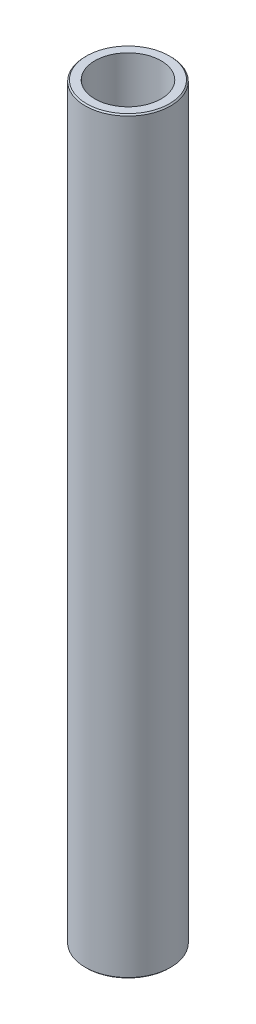
from build123d import *

# Parameters (mm, degrees)
SKETCH1_R           = 25
BOSS_EXTRUDE1_DEPTH = 438.441485318
SKETCH2_R           = 19.393643577
CUT_EXTRUDE1_DEPTH  = 440.864679246
CHAMFER1_SIZE       = 0.735331113


with BuildPart() as part:
    # Sketch1 → Boss-Extrude1 (new body)
    with BuildSketch(Plane(origin=(0, 0, 0), x_dir=(1, 0, 0), z_dir=(0, 1, 0))):
        Circle(SKETCH1_R)
    extrude(amount=BOSS_EXTRUDE1_DEPTH)

    # Sketch2 → Cut-Extrude1 (cut, through all)
    with BuildSketch(Plane(origin=(0, 0, 0), x_dir=(1, 0, 0), z_dir=(0, 1, 0))):
        Circle(SKETCH2_R)
    extrude(amount=CUT_EXTRUDE1_DEPTH, mode=Mode.SUBTRACT)

    # Chamfer1
    chamfer1_edges = [part.edges().sort_by_distance(p)[0] for p in [
        (-25, 438.441485318, 0),
        (-25, 0, 0),
    ]]
    chamfer(chamfer1_edges, length=CHAMFER1_SIZE)


solid = part.part
